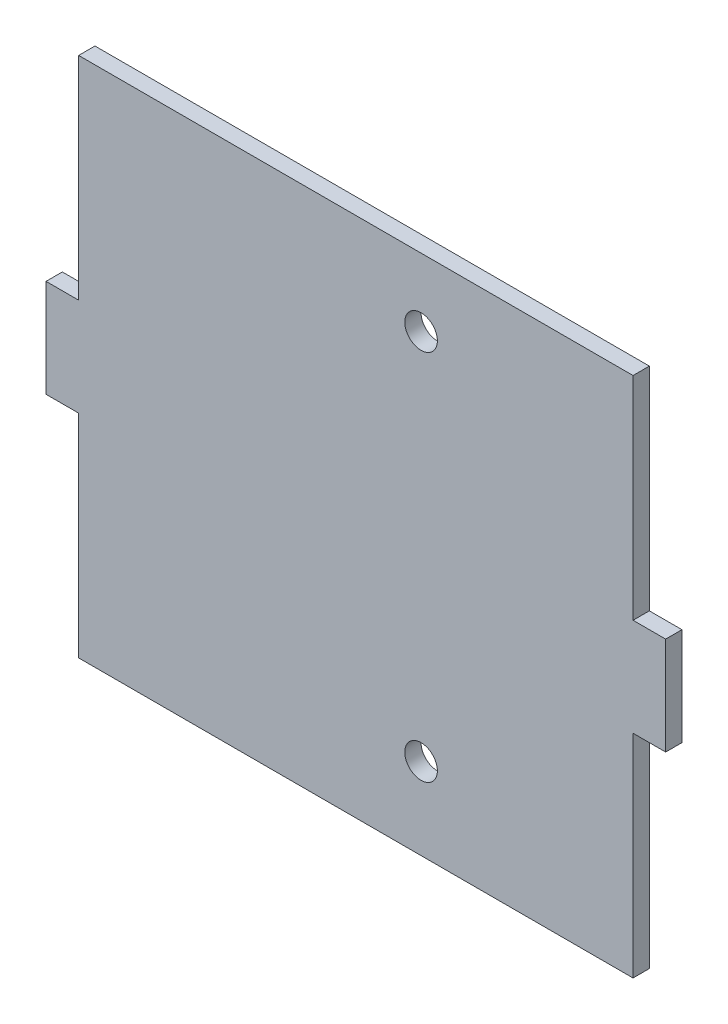
from build123d import *

# Parameters (mm, degrees)
BOSS_EXTRUDE1_DEPTH = 6.35
CAVITY1_START       = -6.35
CAVITY1_OUTLINE_R   = 12.7
CAVITY1_DEPTH       = 12.7


# Read off the part's stored shape, not the designer's step: Cavity1
with BuildPart() as part:
    # Sketch1 → Boss-Extrude1 (new, symmetric)
    with BuildSketch(Plane.XY):
        Polygon((-215.9, -38.1), (-215.9, -203.2), (215.9, -203.2), (215.9, -38.1), (241.3, -38.1), (241.3, 38.1), (215.9, 38.1), (215.9, 203.2), (-215.9, 203.2), (-215.9, 38.1), (-241.3, 38.1), (-241.3, -38.1), align=None)
    extrude(amount=BOSS_EXTRUDE1_DEPTH, both=True)

    # Cavity1 outline → Cavity1 (cut)
    with BuildSketch(Plane.XY.offset(CAVITY1_START)):
        with Locations((50.8, -139.7)):
            Circle(CAVITY1_OUTLINE_R)
        with Locations((50.8, 150.3)):
            Circle(CAVITY1_OUTLINE_R)
    extrude(amount=CAVITY1_DEPTH, mode=Mode.SUBTRACT)


solid = part.part
